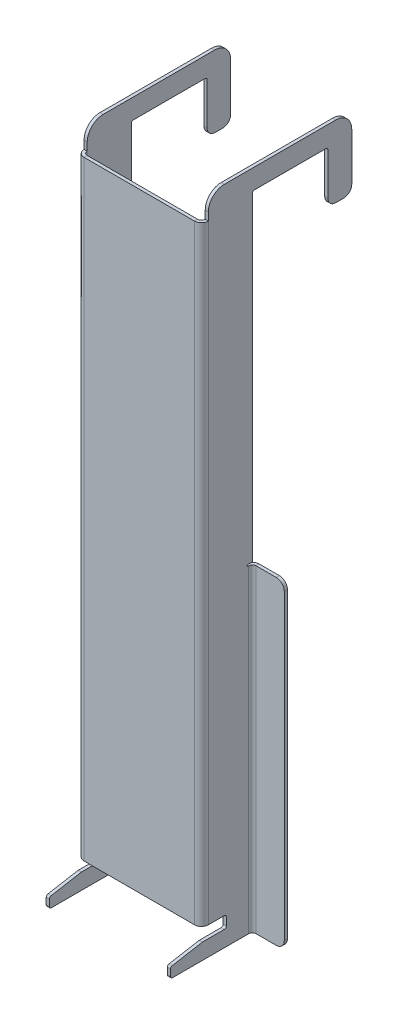
from build123d import *

# Parameters (mm, degrees)
SKETCH1_W                     = 99.06
SKETCH1_H                     = 508
BASE_FLANGE1_DEPTH            = 2.5
EDGE_FLANGE1_STRIP_W          = 16
EDGE_FLANGE1_STRIP_H          = 2.5
EDGE_FLANGE1_STRIP_CUT_DEPTH  = 508
EDGE_FLANGE1_DEPTH            = 508
EDGE_FLANGE2_STRIP_W          = 16
EDGE_FLANGE2_STRIP_H          = 2.5
EDGE_FLANGE2_STRIP_CUT_DEPTH  = 254
EDGE_FLANGE2_RELIEF_W         = 17.25
EDGE_FLANGE2_RELIEF_H         = 1.25
EDGE_FLANGE2_RELIEF_CUT_DEPTH = 2.5
EDGE_FLANGE2_DEPTH            = 254
EDGE_FLANGE2_START            = 2.5
EDGE_FLANGE2_FLAT_DEPTH       = 2.5
EDGE_FLANGE3_STRIP_W          = 16
EDGE_FLANGE3_STRIP_H          = 2.5
EDGE_FLANGE3_STRIP_CUT_DEPTH  = 508
EDGE_FLANGE3_DEPTH            = 508
EDGE_FLANGE4_STRIP_W          = 16
EDGE_FLANGE4_STRIP_H          = 2.5
EDGE_FLANGE4_STRIP_CUT_DEPTH  = 254
EDGE_FLANGE4_RELIEF_W         = 17.25
EDGE_FLANGE4_RELIEF_H         = 1.25
EDGE_FLANGE4_RELIEF_CUT_DEPTH = 2.5
EDGE_FLANGE4_DEPTH            = 254
EDGE_FLANGE4_START            = 2.5
EDGE_FLANGE4_FLAT_DEPTH       = 2.5
SKETCH22_W                    = 5.5
SKETCH22_H                    = 22.225
CUT_EXTRUDE5_DEPTH            = 287.118684465
TAB1_DEPTH                    = 2.5
TAB2_START                    = -2.5
TAB2_DEPTH                    = 2.5
TAB3_DEPTH                    = 2.5
TAB4_START                    = -2.5
TAB4_DEPTH                    = 2.5
SKETCH47_W                    = 14.2875
SKETCH47_H                    = 9.525
CUT_EXTRUDE6_DEPTH            = 337.63035334
FILLET2_R                     = 1.5875
FILLET3_R                     = 1.5875
SKETCH48_W                    = 2.54
SKETCH48_H                    = 15.875
CUT_EXTRUDE9_DEPTH            = 337.63035334
FILLET4_R                     = 12.7


# Read off the part's stored shape, not the designer's step: Tab2
# Sheet-metal steps are written as plain solids
with BuildPart() as part:
    # Sketch1 → Base-Flange1 (new body)
    with BuildSketch(Plane.XY):
        Rectangle(SKETCH1_W, SKETCH1_H)
    extrude(amount=-BASE_FLANGE1_DEPTH)

    # Edge-Flange1 strip (across the edge) → Edge-Flange1 strip cut (cut)
    with BuildSketch(Plane(origin=(-49.53, -254, -2.5), x_dir=(1, 0, 0), z_dir=(0, 1, 0))):
        with Locations((-2.5, -1.25)):
            Rectangle(EDGE_FLANGE1_STRIP_W, EDGE_FLANGE1_STRIP_H)
    extrude(amount=EDGE_FLANGE1_STRIP_CUT_DEPTH, mode=Mode.SUBTRACT)

    # Edge-Flange1 section (across the edge) → Edge-Flange1 (add)
    with BuildSketch(Plane(origin=(-49.53, -254, -2.5), x_dir=(1, 0, 0), z_dir=(0, 1, 0))):
        with BuildLine():
            Line((0, 3), (0, 38.1))
            Line((0, 38.1), (2.5, 38.1))
            Line((2.5, 38.1), (2.5, 3))
            ThreePointArc((2.5, 3), (3.378679656, 0.878679656), (5.5, 0))
            Line((5.5, 0), (5.5, -2.5))
            ThreePointArc((5.5, -2.5), (1.610912703, -0.889087297), (0, 3))
        make_face()
    extrude(amount=EDGE_FLANGE1_DEPTH)

    # Edge-Flange2 strip (across the edge) → Edge-Flange2 strip cut (cut)
    with BuildSketch(Plane(origin=(-49.53, 0, -40.6), x_dir=(0, 0, 1), z_dir=(0, -1, 0))):
        with Locations((-5, -1.25)):
            Rectangle(EDGE_FLANGE2_STRIP_W, EDGE_FLANGE2_STRIP_H)
    extrude(amount=EDGE_FLANGE2_STRIP_CUT_DEPTH, mode=Mode.SUBTRACT)

    # Edge-Flange2 relief (on the sheet) → Edge-Flange2 relief cut (cut)
    with BuildSketch(Plane(origin=(-49.53, 0, -37.6), x_dir=(0, 0, 1), z_dir=(-1, 0, 0))):
        with Locations((-7.375, 0.625)):
            Rectangle(EDGE_FLANGE2_RELIEF_W, EDGE_FLANGE2_RELIEF_H)
    extrude(amount=-EDGE_FLANGE2_RELIEF_CUT_DEPTH, mode=Mode.SUBTRACT)

    # Edge-Flange2 bend section (across the edge) → Edge-Flange2 (add)
    with BuildSketch(Plane(origin=(-49.53, 0, -40.6), x_dir=(0, 0, 1), z_dir=(0, -1, 0))):
        with BuildLine():
            Line((-2.5, 3), (0, 3))
            ThreePointArc((0, 3), (0.878679656, 0.878679656), (3, 0))
            Line((3, 0), (3, -2.5))
            ThreePointArc((3, -2.5), (-0.889087297, -0.889087297), (-2.5, 3))
        make_face()
    extrude(amount=EDGE_FLANGE2_DEPTH)

    # Edge-Flange2 profile (on flange) → Edge-Flange2 flat (add)
    with BuildSketch(Plane(origin=(-49.53, 0, -40.6), x_dir=(0, -1, 0), z_dir=(0, 0, -1)).offset(EDGE_FLANGE2_START)):
        with BuildLine():
            Line((254, 3), (254, 19.05))
            ThreePointArc((254, 19.05), (252.140128061, 23.540128061), (247.65, 25.4))
            Line((247.65, 25.4), (6.35, 25.4))
            ThreePointArc((6.35, 25.4), (1.859871939, 23.540128061), (0, 19.05))
            Line((0, 19.05), (0, 3))
            Line((0, 3), (254, 3))
        make_face()
    extrude(amount=-EDGE_FLANGE2_FLAT_DEPTH)

    # Edge-Flange3 strip (across the edge) → Edge-Flange3 strip cut (cut)
    with BuildSketch(Plane(origin=(49.53, 254, -2.5), x_dir=(-1, 0, 0), z_dir=(0, -1, 0))):
        with Locations((-2.5, -1.25)):
            Rectangle(EDGE_FLANGE3_STRIP_W, EDGE_FLANGE3_STRIP_H)
    extrude(amount=EDGE_FLANGE3_STRIP_CUT_DEPTH, mode=Mode.SUBTRACT)

    # Edge-Flange3 section (across the edge) → Edge-Flange3 (add)
    with BuildSketch(Plane(origin=(49.53, 254, -2.5), x_dir=(-1, 0, 0), z_dir=(0, -1, 0))):
        with BuildLine():
            Line((0, 3), (0, 38.1))
            Line((0, 38.1), (2.5, 38.1))
            Line((2.5, 38.1), (2.5, 3))
            ThreePointArc((2.5, 3), (3.378679656, 0.878679656), (5.5, 0))
            Line((5.5, 0), (5.5, -2.5))
            ThreePointArc((5.5, -2.5), (1.610912703, -0.889087297), (0, 3))
        make_face()
    extrude(amount=EDGE_FLANGE3_DEPTH)

    # Edge-Flange4 strip (across the edge) → Edge-Flange4 strip cut (cut)
    with BuildSketch(Plane(origin=(49.53, -254, -40.6), x_dir=(0, 0, 1), z_dir=(0, 1, 0))):
        with Locations((-5, -1.25)):
            Rectangle(EDGE_FLANGE4_STRIP_W, EDGE_FLANGE4_STRIP_H)
    extrude(amount=EDGE_FLANGE4_STRIP_CUT_DEPTH, mode=Mode.SUBTRACT)

    # Edge-Flange4 relief (on the sheet) → Edge-Flange4 relief cut (cut)
    with BuildSketch(Plane(origin=(49.53, -254, -37.6), x_dir=(0, 0, 1), z_dir=(1, 0, 0))):
        with Locations((-7.375, -254.625)):
            Rectangle(EDGE_FLANGE4_RELIEF_W, EDGE_FLANGE4_RELIEF_H)
    extrude(amount=-EDGE_FLANGE4_RELIEF_CUT_DEPTH, mode=Mode.SUBTRACT)

    # Edge-Flange4 bend section (across the edge) → Edge-Flange4 (add)
    with BuildSketch(Plane(origin=(49.53, -254, -40.6), x_dir=(0, 0, 1), z_dir=(0, 1, 0))):
        with BuildLine():
            Line((-2.5, 3), (0, 3))
            ThreePointArc((0, 3), (0.878679656, 0.878679656), (3, 0))
            Line((3, 0), (3, -2.5))
            ThreePointArc((3, -2.5), (-0.889087297, -0.889087297), (-2.5, 3))
        make_face()
    extrude(amount=EDGE_FLANGE4_DEPTH)

    # Edge-Flange4 profile (on flange) → Edge-Flange4 flat (add)
    with BuildSketch(Plane(origin=(49.53, 0, -40.6), x_dir=(0, 1, 0), z_dir=(0, 0, -1)).offset(EDGE_FLANGE4_START)):
        with BuildLine():
            Line((-254, 19.05), (-254, 3))
            Line((-254, 3), (0, 3))
            Line((0, 3), (0, 19.05))
            ThreePointArc((0, 19.05), (-1.859871939, 23.540128061), (-6.35, 25.4))
            Line((-6.35, 25.4), (-247.65, 25.4))
            ThreePointArc((-247.65, 25.4), (-252.140128061, 23.540128061), (-254, 19.05))
        make_face()
    extrude(amount=-EDGE_FLANGE4_FLAT_DEPTH)

    # Sketch22 → Cut-Extrude5 (cut, through all)
    with BuildSketch(Plane.ZY.offset(49.53)):
        with Locations((-2.75, -242.8875)):
            Rectangle(SKETCH22_W, SKETCH22_H)
    extrude(amount=-CUT_EXTRUDE5_DEPTH, mode=Mode.SUBTRACT)

    # Sketch30 → Tab1 (add)
    with BuildSketch(Plane.ZY.offset(49.53)):
        Polygon((-5.5, -254), (24.6625, -254), (24.6625, -245.77870531), (-0.7375, -241.3), (-5.5, -241.3), align=None)
    extrude(amount=-TAB1_DEPTH)

    # Tab2 outline → Tab2 (add)
    with BuildSketch(Plane(origin=(49.53, 0, 0), x_dir=(0, 0, -1), z_dir=(1, 0, 0)).offset(TAB2_START)):
        Polygon((-24.6625, -254), (5.5, -254), (5.5, -241.3), (0.7375, -241.3), (-24.6625, -245.77870531), align=None)
    extrude(amount=TAB2_DEPTH)

    # Sketch43 → Tab3 (add)
    with BuildSketch(Plane(origin=(49.53, 0, 0), x_dir=(0, 0, -1), z_dir=(1, 0, 0))):
        with BuildLine():
            Line((8.675031572, 288.925), (116.625031572, 288.925))
            ThreePointArc((116.625031572, 288.925), (118.870095602, 287.99506403), (119.800031572, 285.75))
            Line((119.800031572, 285.75), (119.800031572, 254))
            Line((119.800031572, 254), (119.800031572, 222.25))
            ThreePointArc((119.800031572, 222.25), (117.940159632, 217.759871939), (113.450031572, 215.9))
            Line((113.450031572, 215.9), (107.100031572, 215.9))
            ThreePointArc((107.100031572, 215.9), (102.609903511, 217.759871939), (100.750031572, 222.25))
            Line((100.750031572, 222.25), (100.750031572, 250.825))
            Line((100.750031572, 250.825), (100.750031572, 254))
            Line((100.750031572, 254), (100.750031572, 255.5875))
            ThreePointArc((100.750031572, 255.5875), (100.285063587, 256.710032015), (99.162531572, 257.175))
            Line((99.162531572, 257.175), (42.1875, 257.175))
            ThreePointArc((42.1875, 257.175), (41.064967985, 256.710032015), (40.6, 255.5875))
            Line((40.6, 255.5875), (40.6, 254))
            Line((40.6, 254), (5.500031572, 254))
            Line((5.500031572, 254), (5.500031572, 285.75))
            ThreePointArc((5.500031572, 285.75), (6.429967542, 287.99506403), (8.675031572, 288.925))
        make_face()
    extrude(amount=-TAB3_DEPTH)

    # Sketch46 → Tab4 (add)
    with BuildSketch(Plane.ZY.offset(49.53).offset(TAB4_START)):
        with BuildLine():
            Line((-116.625, 288.925), (-8.675, 288.925))
            ThreePointArc((-8.675, 288.925), (-6.42993597, 287.99506403), (-5.5, 285.75))
            Line((-5.5, 285.75), (-5.5, 254))
            Line((-5.5, 254), (-40.6, 254))
            Line((-40.6, 254), (-40.6, 255.5875))
            ThreePointArc((-40.6, 255.5875), (-41.064967985, 256.710032015), (-42.1875, 257.175))
            Line((-42.1875, 257.175), (-99.458781194, 257.175))
            ThreePointArc((-99.458781194, 257.175), (-100.581313209, 256.710032015), (-101.046281194, 255.5875))
            Line((-101.046281194, 255.5875), (-101.046281194, 254))
            Line((-101.046281194, 254), (-101.046281194, 222.25))
            ThreePointArc((-101.046281194, 222.25), (-102.906153133, 217.759871939), (-107.396281194, 215.9))
            Line((-107.396281194, 215.9), (-113.45, 215.9))
            ThreePointArc((-113.45, 215.9), (-117.940128061, 217.759871939), (-119.8, 222.25))
            Line((-119.8, 222.25), (-119.8, 254))
            Line((-119.8, 254), (-119.8, 285.75))
            ThreePointArc((-119.8, 285.75), (-118.87006403, 287.99506403), (-116.625, 288.925))
        make_face()
    extrude(amount=TAB4_DEPTH)

    # Sketch47 → Cut-Extrude6 (cut, through all)
    with BuildSketch(Plane.ZY.offset(49.53)):
        with Locations((-12.64375, -236.5375)):
            Rectangle(SKETCH47_W, SKETCH47_H)
    extrude(amount=-CUT_EXTRUDE6_DEPTH, mode=Mode.SUBTRACT)

    # Fillet2
    fillet2_edges = [part.edges().sort_by_distance(p)[0] for p in [
        (48.28, -231.775, -19.7875),
        (48.28, -241.3, -19.7875),
        (-48.28, -231.775, -19.7875),
        (-48.28, -241.3, -19.7875),
    ]]
    fillet(fillet2_edges, radius=FILLET2_R)

    # Fillet3
    fillet3_edges = [part.edges().sort_by_distance(p)[0] for p in [
        (-48.28, -241.3, -0.7375),
        (-48.28, -245.77870531, 24.6625),
        (-48.28, -254, 24.6625),
        (48.28, -254, 24.6625),
        (48.28, -245.77870531, 24.6625),
        (48.28, -241.3, -0.7375),
    ]]
    fillet(fillet3_edges, radius=FILLET3_R)

    # Sketch48 → Cut-Extrude9 (cut, through all)
    with BuildSketch(Plane.ZY.offset(49.53)):
        with BuildLine():
            Line((-8.675, 288.925), (-116.625, 288.925))
            ThreePointArc((-116.625, 288.925), (-118.87006403, 287.99506403), (-119.8, 285.75))
            Line((-119.8, 285.75), (-119.8, 273.05))
            Line((-119.8, 273.05), (-5.5, 273.05))
            Line((-5.5, 273.05), (-5.5, 285.75))
            ThreePointArc((-5.5, 285.75), (-6.42993597, 287.99506403), (-8.675, 288.925))
        make_face()
        with Locations((-121.07, 280.9875)):
            Rectangle(SKETCH48_W, SKETCH48_H)
    extrude(amount=-CUT_EXTRUDE9_DEPTH, mode=Mode.SUBTRACT)


with BuildPart() as cut_extrude9_kept_piece:
    # of the separate pieces the step leaves, the one the design keeps (cut_extrude9_pieces_kept)
    add(part.part.solids().sort_by_distance((47.03, -241.3, -0.876388253))[0])

    # Fillet4
    fillet4_edges = [cut_extrude9_kept_piece.edges().sort_by_distance(p)[0] for p in [
        (-48.28, 273.05, -119.8),
        (48.28, 273.05, -5.500031572),
        (48.28, 273.05, -119.800031572),
        (-48.28, 273.05, -5.5),
    ]]
    fillet(fillet4_edges, radius=FILLET4_R)


solid = cut_extrude9_kept_piece.part
